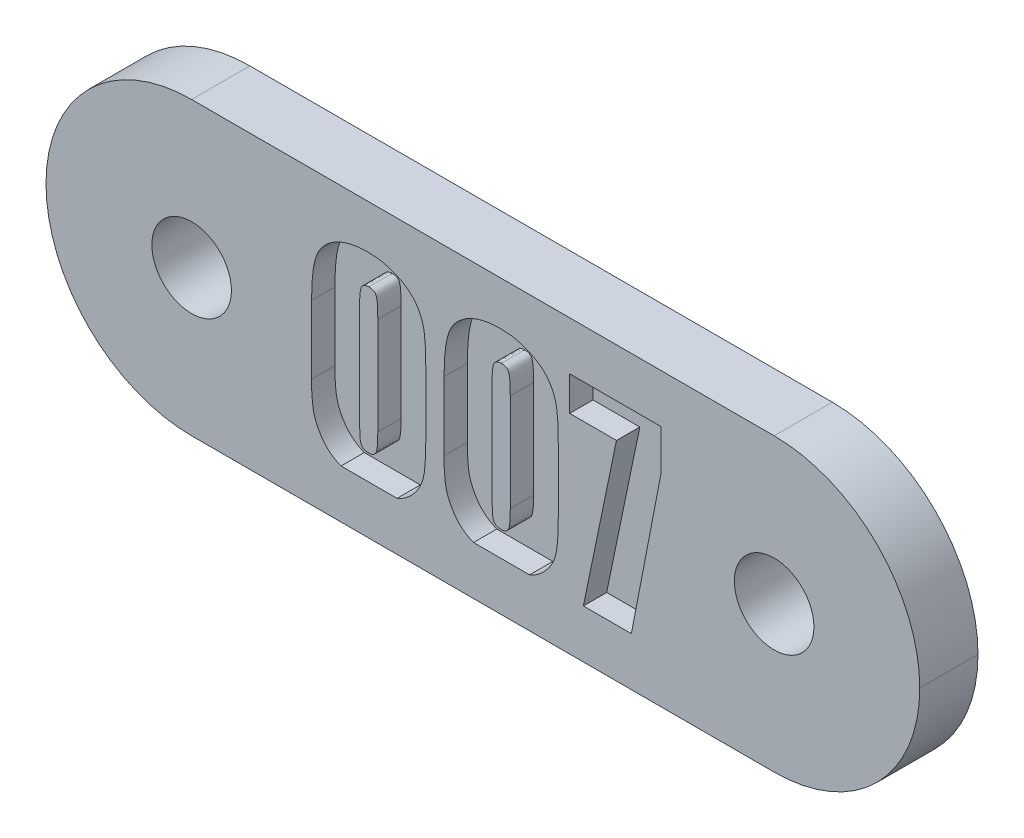
from build123d import *

# Parameters (mm, degrees)
SKETCH1_W           = 45
SKETCH1_H           = 15
BOSS_EXTRUDE1_DEPTH = 3
SKETCH2_R           = 2.05
CUT_EXTRUDE1_DEPTH  = 4
CUT_EXTRUDE2_DEPTH  = 1.2
FILLET1_R           = 7.5


with BuildPart() as part:
    # Sketch1 → Boss-Extrude1 (new body)
    with BuildSketch(Plane.XY):
        Rectangle(SKETCH1_W, SKETCH1_H)
    extrude(amount=BOSS_EXTRUDE1_DEPTH)

    # Sketch2 → Cut-Extrude1 (cut)
    with BuildSketch(Plane.XY.offset(3)):
        with Locations((15, 0)):
            Circle(SKETCH2_R)
        with Locations((-15, 0)):
            Circle(SKETCH2_R)
    extrude(amount=-CUT_EXTRUDE1_DEPTH, mode=Mode.SUBTRACT)

    # Sketch5 → Cut-Extrude2 (cut)
    # profile 1 of 3: a face of its own
    with BuildSketch(Plane.XY.offset(3)):
        with BuildLine():
            Line((-7.306572756, -5), (-4.420063331, -5))
            add(Edge.make_bspline(
                [(-2.941176471, -1.735294118), (-2.940816439, -1.913035159), (-2.944894504, -2.170414493), (-2.955720239, -2.500212028), (-2.972166236, -2.718805078), (-2.986336178, -2.917740056), (-3.010057597, -3.097027606), (-3.03226531, -3.25751853), (-3.071225395, -3.445496416), (-3.138676972, -3.664359044), (-3.249853571, -3.915546816), (-3.396626084, -4.15684822), (-3.573666601, -4.385975155), (-3.774814568, -4.597199981), (-4.00226228, -4.776574475), (-4.21869942, -4.909706141), (-4.362266699, -4.976096223), (-4.420063331, -5)],
                knots=[0, 0, 0, 0, 0.10260447, 0.148627955, 0.19046808, 0.229159713, 0.263736533, 0.294855812, 0.322677598, 0.374488206, 0.42675096, 0.480868949, 0.537122072, 0.593664782, 0.648803382, 0.703893162, 0.739971513, 0.739971513, 0.739971513, 0.739971513], degree=3))
            Line((-2.941176471, -1.735294118), (-2.941176471, 1.628676471))
            add(Edge.make_bspline(
                [(-5.928308824, 5.235294118), (-5.668131978, 5.23328822), (-5.283143276, 5.205155645), (-4.79541817, 5.079066081), (-4.462646153, 4.95288258), (-4.161973256, 4.801177296), (-3.895423378, 4.634750367), (-3.671104557, 4.44897762), (-3.487657947, 4.245091312), (-3.340693167, 4.026322031), (-3.215221359, 3.797876167), (-3.119999976, 3.553444944), (-3.062189824, 3.338069208), (-3.024717524, 3.152124498), (-3.004395672, 2.991617969), (-2.983746283, 2.812172688), (-2.96690232, 2.612978952), (-2.957403691, 2.394645394), (-2.94353018, 2.064490259), (-2.941546729, 1.806985681), (-2.941176471, 1.628676471)],
                knots=[0, 0, 0, 0, 0.143725383, 0.211434072, 0.277216669, 0.339639533, 0.396925095, 0.450193616, 0.499732366, 0.547634684, 0.595269188, 0.643217981, 0.691919593, 0.718100771, 0.747782488, 0.78111148, 0.817738693, 0.858008139, 0.901638927, 1, 1, 1, 1], degree=3))
            add(Edge.make_bspline(
                [(-8.823529412, 1.628676471), (-8.823581608, 1.84565969), (-8.817256924, 2.160907575), (-8.792682309, 2.565936961), (-8.766707908, 2.837491868), (-8.735338437, 3.086867229), (-8.691753167, 3.31399819), (-8.645393612, 3.520032389), (-8.589766832, 3.707032899), (-8.523706253, 3.879693951), (-8.439698177, 4.039274427), (-8.343938133, 4.192200755), (-8.231261975, 4.334605819), (-8.105957483, 4.47005025), (-7.96482049, 4.595122854), (-7.810386702, 4.713087445), (-7.641321598, 4.821305375), (-7.460296026, 4.917650031), (-7.269597238, 5.003315215), (-7.069036712, 5.074493368), (-6.858985195, 5.133421086), (-6.639706926, 5.179058511), (-6.329480745, 5.224792609), (-6.090169599, 5.232668951), (-5.928308824, 5.235294118)],
                knots=[0, 0, 0, 0, 0.121110592, 0.17593866, 0.22644134, 0.273360064, 0.316156196, 0.355479691, 0.391186384, 0.424974291, 0.45847363, 0.491681894, 0.525547603, 0.559667946, 0.594546065, 0.630663155, 0.668042309, 0.706447853, 0.745028124, 0.784621377, 0.825117215, 0.866704611, 0.909558102, 1, 1, 1, 1], degree=3))
            Line((-8.823529412, 1.628676471), (-8.823529412, -1.889705882))
            add(Edge.make_bspline(
                [(-7.306572756, -5), (-7.376813076, -4.972809551), (-7.534619378, -4.902815646), (-7.764228807, -4.765458317), (-7.990000531, -4.589244454), (-8.179828051, -4.380886785), (-8.34181374, -4.15790955), (-8.478519882, -3.925594768), (-8.593536488, -3.689771948), (-8.667059013, -3.48405849), (-8.714739866, -3.308783546), (-8.742342584, -3.15855083), (-8.768948893, -2.990754987), (-8.787776753, -2.805350173), (-8.805197558, -2.601962359), (-8.818797984, -2.294864827), (-8.82500667, -2.055228265), (-8.823529412, -1.889705882)],
                knots=[0.29983978, 0.29983978, 0.29983978, 0.29983978, 0.342425035, 0.397311555, 0.450867671, 0.503862998, 0.556224994, 0.606592758, 0.656219886, 0.704477513, 0.72996215, 0.75893084, 0.790855204, 0.826082806, 0.864351411, 0.90635823, 1, 1, 1, 1], degree=3))
        make_face()
        with BuildLine():
            Line((-6.352941176, -2.459558824), (-6.352941176, 2.490808824))
            add(Edge.make_bspline(
                [(-5.873161765, 3.705882353), (-5.955533628, 3.706948361), (-6.080483084, 3.687801713), (-6.206477339, 3.588120731), (-6.255684803, 3.504015403), (-6.284306939, 3.421556385), (-6.30107561, 3.340446809), (-6.318325235, 3.242513692), (-6.329880905, 3.126347019), (-6.341383047, 2.992821583), (-6.351216366, 2.778908193), (-6.35175329, 2.609683844), (-6.352941176, 2.490808824)],
                knots=[0, 0, 0, 0, 0.169512528, 0.24292967, 0.318863278, 0.3637035, 0.419819276, 0.486675987, 0.565507715, 0.656599864, 0.758699932, 1, 1, 1, 1], degree=3))
            add(Edge.make_bspline(
                [(-5.411764706, 2.490808824), (-5.412019651, 2.612777547), (-5.415040071, 2.78618249), (-5.421437078, 3.005038342), (-5.431301425, 3.141025526), (-5.441002278, 3.258352241), (-5.455975387, 3.356416663), (-5.472002843, 3.435777335), (-5.49456487, 3.515595673), (-5.539953664, 3.596918706), (-5.667882114, 3.68821493), (-5.7898306, 3.706792842), (-5.873161765, 3.705882353)],
                knots=[0, 0, 0, 0, 0.247594677, 0.352159955, 0.444428194, 0.524395335, 0.591075892, 0.645728396, 0.688624944, 0.759458316, 0.829622139, 1, 1, 1, 1], degree=3))
            Line((-5.411764706, 2.490808824), (-5.411764706, -2.534926471))
            add(Edge.make_bspline(
                [(-5.886029412, -3.705882353), (-5.803523294, -3.707035925), (-5.679828086, -3.687795509), (-5.554428191, -3.590053341), (-5.50686322, -3.506849207), (-5.479241673, -3.426319169), (-5.46074393, -3.347486645), (-5.448188156, -3.252504354), (-5.431254045, -3.141388324), (-5.424434829, -3.012891263), (-5.412667385, -2.809025354), (-5.413420406, -2.647623284), (-5.411764706, -2.534926471)],
                knots=[0, 0, 0, 0, 0.174905928, 0.248855089, 0.325440451, 0.37170736, 0.427108891, 0.494621028, 0.572295184, 0.662348961, 0.763852665, 1, 1, 1, 1], degree=3))
            add(Edge.make_bspline(
                [(-6.352941176, -2.459558824), (-6.351414277, -2.591888667), (-6.351823553, -2.779553625), (-6.340800725, -3.015389373), (-6.332026811, -3.159451495), (-6.321438833, -3.282152026), (-6.308064261, -3.382536484), (-6.289348569, -3.461032929), (-6.265086152, -3.53667543), (-6.212744983, -3.607991876), (-6.087472456, -3.691628763), (-5.967308227, -3.707067569), (-5.886029412, -3.705882353)],
                knots=[0, 0, 0, 0, 0.261808434, 0.370990841, 0.466925788, 0.547243775, 0.614601994, 0.666926436, 0.706791758, 0.771036088, 0.837261786, 1, 1, 1, 1], degree=3))
        make_face(mode=Mode.SUBTRACT)
    # profile 2 of 3: a face of its own
    with BuildSketch(Plane.XY.offset(3)):
        with BuildLine():
            Line((-0.483043344, -5), (2.403466081, -5))
            add(Edge.make_bspline(
                [(3.882352941, -1.735294118), (3.882712973, -1.913035159), (3.878634908, -2.170414493), (3.867809172, -2.500212028), (3.851363176, -2.718805078), (3.837193234, -2.917740056), (3.813471815, -3.097027606), (3.791264102, -3.25751853), (3.752304017, -3.445496416), (3.68485244, -3.664359044), (3.573675841, -3.915546816), (3.426903328, -4.15684822), (3.249862811, -4.385975155), (3.048714843, -4.597199981), (2.821267132, -4.776574475), (2.604829992, -4.909706141), (2.461262712, -4.976096223), (2.403466081, -5)],
                knots=[0, 0, 0, 0, 0.10260447, 0.148627955, 0.19046808, 0.229159713, 0.263736533, 0.294855812, 0.322677598, 0.374488206, 0.42675096, 0.480868949, 0.537122072, 0.593664782, 0.648803382, 0.703893162, 0.739971513, 0.739971513, 0.739971513, 0.739971513], degree=3))
            Line((3.882352941, -1.735294118), (3.882352941, 1.628676471))
            add(Edge.make_bspline(
                [(0.895220588, 5.235294118), (1.155397434, 5.23328822), (1.540386136, 5.205155645), (2.028111241, 5.079066081), (2.360883259, 4.95288258), (2.661556156, 4.801177296), (2.928106034, 4.634750367), (3.152424855, 4.44897762), (3.335871465, 4.245091312), (3.482836244, 4.026322031), (3.608308053, 3.797876167), (3.703529436, 3.553444944), (3.761339588, 3.338069208), (3.798811888, 3.152124498), (3.81913374, 2.991617969), (3.839783128, 2.812172688), (3.856627092, 2.612978952), (3.86612572, 2.394645394), (3.879999232, 2.064490259), (3.881982683, 1.806985681), (3.882352941, 1.628676471)],
                knots=[0, 0, 0, 0, 0.143725383, 0.211434072, 0.277216669, 0.339639533, 0.396925095, 0.450193616, 0.499732366, 0.547634684, 0.595269188, 0.643217981, 0.691919593, 0.718100771, 0.747782488, 0.78111148, 0.817738693, 0.858008139, 0.901638927, 1, 1, 1, 1], degree=3))
            add(Edge.make_bspline(
                [(-2, 1.628676471), (-2.000052196, 1.84565969), (-1.993727512, 2.160907575), (-1.969152898, 2.565936961), (-1.943178496, 2.837491868), (-1.911809025, 3.086867229), (-1.868223755, 3.31399819), (-1.8218642, 3.520032389), (-1.76623742, 3.707032899), (-1.700176842, 3.879693951), (-1.616168766, 4.039274427), (-1.520408721, 4.192200755), (-1.407732563, 4.334605819), (-1.282428071, 4.47005025), (-1.141291078, 4.595122854), (-0.986857291, 4.713087445), (-0.817792186, 4.821305375), (-0.636766615, 4.917650031), (-0.446067826, 5.003315215), (-0.2455073, 5.074493368), (-0.035455783, 5.133421086), (0.183822486, 5.179058511), (0.494048666, 5.224792609), (0.733359813, 5.232668951), (0.895220588, 5.235294118)],
                knots=[0, 0, 0, 0, 0.121110592, 0.17593866, 0.22644134, 0.273360064, 0.316156196, 0.355479691, 0.391186384, 0.424974291, 0.45847363, 0.491681894, 0.525547603, 0.559667946, 0.594546065, 0.630663155, 0.668042309, 0.706447853, 0.745028124, 0.784621377, 0.825117215, 0.866704611, 0.909558102, 1, 1, 1, 1], degree=3))
            Line((-2, 1.628676471), (-2, -1.889705882))
            add(Edge.make_bspline(
                [(-0.483043344, -5), (-0.553283664, -4.972809551), (-0.711089966, -4.902815646), (-0.940699395, -4.765458317), (-1.166471119, -4.589244454), (-1.35629864, -4.380886785), (-1.518284328, -4.15790955), (-1.65499047, -3.925594768), (-1.770007077, -3.689771948), (-1.843529601, -3.48405849), (-1.891210454, -3.308783546), (-1.918813172, -3.15855083), (-1.945419481, -2.990754987), (-1.964247341, -2.805350173), (-1.981668146, -2.601962359), (-1.995268572, -2.294864827), (-2.001477258, -2.055228265), (-2, -1.889705882)],
                knots=[0.29983978, 0.29983978, 0.29983978, 0.29983978, 0.342425035, 0.397311555, 0.450867671, 0.503862998, 0.556224994, 0.606592758, 0.656219886, 0.704477513, 0.72996215, 0.75893084, 0.790855204, 0.826082806, 0.864351411, 0.90635823, 1, 1, 1, 1], degree=3))
        make_face()
        with BuildLine():
            Line((0.470588235, -2.459558824), (0.470588235, 2.490808824))
            add(Edge.make_bspline(
                [(0.950367647, 3.705882353), (0.867995784, 3.706948361), (0.743046327, 3.687801713), (0.617052073, 3.588120731), (0.567844608, 3.504015403), (0.539222473, 3.421556385), (0.522453802, 3.340446809), (0.505204177, 3.242513692), (0.493648507, 3.126347019), (0.482146365, 2.992821583), (0.472313045, 2.778908193), (0.471776121, 2.609683844), (0.470588235, 2.490808824)],
                knots=[0, 0, 0, 0, 0.169512528, 0.24292967, 0.318863278, 0.3637035, 0.419819276, 0.486675987, 0.565507715, 0.656599864, 0.758699932, 1, 1, 1, 1], degree=3))
            add(Edge.make_bspline(
                [(1.411764706, 2.490808824), (1.41150976, 2.612777547), (1.408489341, 2.78618249), (1.402092333, 3.005038342), (1.392227987, 3.141025526), (1.382527134, 3.258352241), (1.367554025, 3.356416663), (1.351526568, 3.435777335), (1.328964541, 3.515595673), (1.283575748, 3.596918706), (1.155647298, 3.68821493), (1.033698811, 3.706792842), (0.950367647, 3.705882353)],
                knots=[0, 0, 0, 0, 0.247594677, 0.352159955, 0.444428194, 0.524395335, 0.591075892, 0.645728396, 0.688624944, 0.759458316, 0.829622139, 1, 1, 1, 1], degree=3))
            Line((1.411764706, 2.490808824), (1.411764706, -2.534926471))
            add(Edge.make_bspline(
                [(0.9375, -3.705882353), (1.020006118, -3.707035925), (1.143701326, -3.687795509), (1.269101221, -3.590053341), (1.316666192, -3.506849207), (1.344287739, -3.426319169), (1.362785482, -3.347486645), (1.375341256, -3.252504354), (1.392275367, -3.141388324), (1.399094583, -3.012891263), (1.410862027, -2.809025354), (1.410109005, -2.647623284), (1.411764706, -2.534926471)],
                knots=[0, 0, 0, 0, 0.174905928, 0.248855089, 0.325440451, 0.37170736, 0.427108891, 0.494621028, 0.572295184, 0.662348961, 0.763852665, 1, 1, 1, 1], degree=3))
            add(Edge.make_bspline(
                [(0.470588235, -2.459558824), (0.472115135, -2.591888667), (0.471705858, -2.779553625), (0.482728687, -3.015389373), (0.491502601, -3.159451495), (0.502090579, -3.282152026), (0.515465151, -3.382536484), (0.534180843, -3.461032929), (0.55844326, -3.53667543), (0.610784429, -3.607991876), (0.736056955, -3.691628763), (0.856221185, -3.707067569), (0.9375, -3.705882353)],
                knots=[0, 0, 0, 0, 0.261808434, 0.370990841, 0.466925788, 0.547243775, 0.614601994, 0.666926436, 0.706791758, 0.771036088, 0.837261786, 1, 1, 1, 1], degree=3))
        make_face(mode=Mode.SUBTRACT)
    # profile 3 of 3: a face of its own
    with BuildSketch(Plane.XY.offset(3)):
        Polygon((6.882352941, 3.235294118), (5.176470588, -5), (7.647058824, -5), (9.176470588, 2.911764706), (9.176470588, 5), (4.470588235, 5), (4.470588235, 3.235294118), align=None)
    extrude(amount=-CUT_EXTRUDE2_DEPTH, mode=Mode.SUBTRACT)

    # Fillet1
    fillet1_edges = [part.edges().sort_by_distance(p)[0] for p in [
        (22.5, 7.5, 1.5),
        (22.5, -7.5, 1.5),
        (-22.5, -7.5, 1.5),
        (-22.5, 7.5, 1.5),
    ]]
    fillet(fillet1_edges, radius=FILLET1_R - 0.0001)  # a hair under: the kernel refuses the full size


solid = part.part
